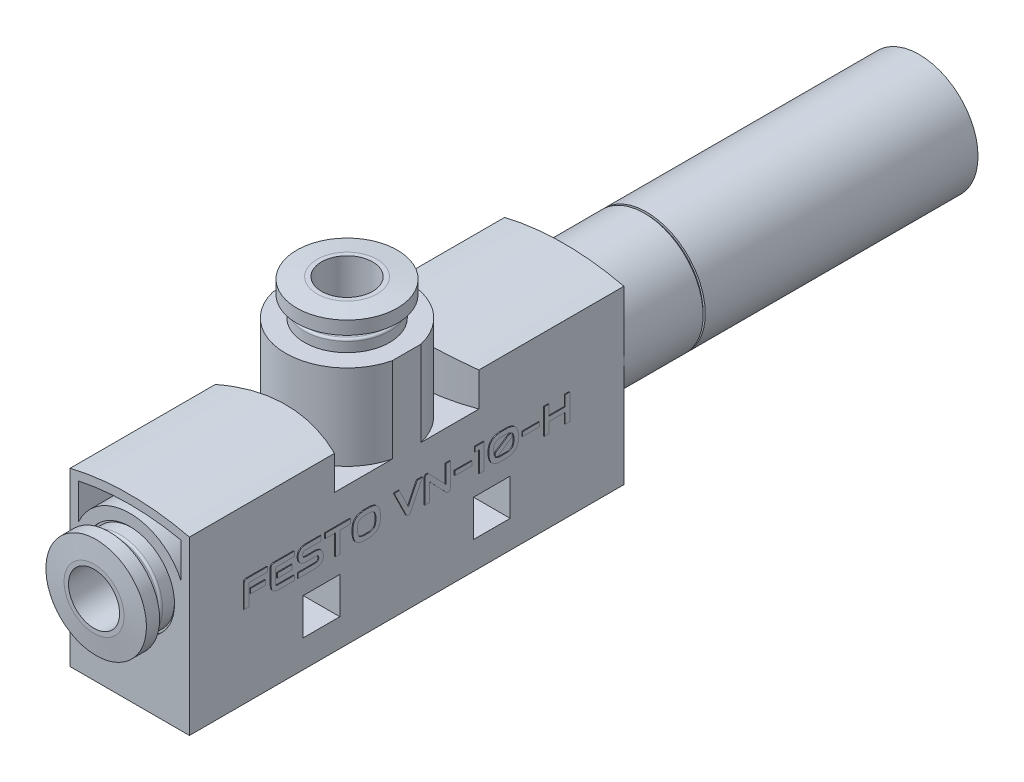
from build123d import *

# Parameters (mm, degrees)
SKETCH1_W               = 51
SKETCH1_H               = 21
BOSS_EXTRUDE1_DEPTH     = 7
CUT_EXTRUDE1_DEPTH      = 31.927334188
CUT_EXTRUDE1_DEPTH_BACK = 31.927334188
SKETCH2_W               = 4.3
SKETCH2_H               = 4.3
SKETCH3_R               = 6.9
BOSS_EXTRUDE2_DEPTH     = 42.4
SKETCH4_W               = 0.25
SKETCH4_H               = 0.25
SKETCH5_R               = 5
BOSS_EXTRUDE3_DEPTH     = 1.4
SKETCH6_R               = 4.05
BOSS_EXTRUDE4_DEPTH     = 1
SKETCH7_R               = 5.9
BOSS_EXTRUDE5_DEPTH     = 1.8
SKETCH8_R               = 3
CUT_EXTRUDE2_DEPTH      = 32.8
CHAMFER1_SIZE           = 0.25
CHAMFER1_SIZE2          = 2.378591114
CUT_EXTRUDE3_DEPTH      = 95.248660468
CUT_EXTRUDE3_DEPTH_BACK = 95.248660468
CUT_EXTRUDE4_DEPTH      = 10
CUT_EXTRUDE5_START      = -0.25
SKETCH10_3_R            = 5.25
SKETCH10_3_R_2          = 5
CUT_EXTRUDE5_DEPTH      = 0.25
BOSS_EXTRUDE6_DEPTH     = 15.7
CUT_EXTRUDE6_START      = -10
CUT_EXTRUDE6_DEPTH      = 10
SKETCH13_R              = 5
BOSS_EXTRUDE7_DEPTH     = 1.4
SKETCH14_R              = 4.05
BOSS_EXTRUDE8_DEPTH     = 1
SKETCH15_R              = 5.9
BOSS_EXTRUDE9_DEPTH     = 1.8
SKETCH16_R              = 3
CUT_EXTRUDE7_DEPTH      = 23.8
SKETCH17_R              = 3
CUT_EXTRUDE8_DEPTH      = 52.8
CHAMFER2_SIZE           = 0.25
CHAMFER2_SIZE2          = 2.378591114
FILLET1_R               = 0.25
WRAP1_OUTLINE_W         = 1.719421487
WRAP1_OUTLINE_H         = 0.547933884
WRAP1_OUTLINE_W_2       = 1.717561983
WRAP1_OUTLINE_W_3       = 1.96177686
WRAP1_OUTLINE_H_2       = 0.489669421
WRAP1_OUTLINE_W_4       = 1.961776859
WRAP1_DEPTH             = 0.1


# Read off the part's stored shape, not the designer's step: Wrap1
with BuildPart() as part:
    # Sketch1 → Boss-Extrude1 (new, symmetric)
    with BuildSketch(Plane(origin=(0, 0, 0), x_dir=(0, 0, -1), z_dir=(1, 0, 0))):
        Rectangle(SKETCH1_W, SKETCH1_H)
    extrude(amount=BOSS_EXTRUDE1_DEPTH, both=True)

    # Sketch2 → Cut-Extrude1 (cut, two sides: drawn at the far end of the back side and taken through both)
    with BuildSketch(Plane(origin=(7, 0, 0), x_dir=(0, 0, -1), z_dir=(1, 0, 0)).offset(-CUT_EXTRUDE1_DEPTH_BACK)):
        with Locations((-10, -5.1)):
            Rectangle(SKETCH2_W, SKETCH2_H)
        with Locations((10, -5.1)):
            Rectangle(SKETCH2_W, SKETCH2_H)
    extrude(amount=CUT_EXTRUDE1_DEPTH + CUT_EXTRUDE1_DEPTH_BACK, mode=Mode.SUBTRACT)

    # Sketch3 → Boss-Extrude2 (add)
    with BuildSketch(Plane(origin=(0, 0, -25.5), x_dir=(-1, 0, 0), z_dir=(0, 0, -1))):
        with Locations((0, 2)):
            Circle(SKETCH3_R)
    extrude(amount=BOSS_EXTRUDE2_DEPTH)

    # Sketch4 → Cut-Revolve6 (revolve, cut)
    with BuildSketch(Plane(origin=(0, 0, 0), x_dir=(0, 0, -1), z_dir=(1, 0, 0)), mode=Mode.PRIVATE) as cut_revolve6_sk:
        with Locations((35.025, 8.775)):
            Rectangle(SKETCH4_W, SKETCH4_H)
    revolve(cut_revolve6_sk.sketch.rotate(Axis((0, 2, -25.5), (0, 0, -1)), 90), axis=Axis((0, 2, -25.5), (0, 0, -1)), mode=Mode.SUBTRACT)

    # Sketch5 → Boss-Extrude3 (add)
    with BuildSketch(Plane.XY.offset(25.5)):
        with Locations((0, 2)):
            Circle(SKETCH5_R)
    extrude(amount=BOSS_EXTRUDE3_DEPTH)

    # Sketch6 → Boss-Extrude4 (add)
    with BuildSketch(Plane.XY.offset(26.9)):
        with Locations((0, 2)):
            Circle(SKETCH6_R)
    extrude(amount=BOSS_EXTRUDE4_DEPTH)

    # Sketch7 → Boss-Extrude5 (add)
    with BuildSketch(Plane.XY.offset(27.9)):
        with Locations((0, 2)):
            Circle(SKETCH7_R)
    extrude(amount=BOSS_EXTRUDE5_DEPTH)

    # Sketch8 → Cut-Extrude2 (cut)
    with BuildSketch(Plane.XY.offset(29.7)):
        with Locations((0, 2)):
            Circle(SKETCH8_R)
    extrude(amount=-CUT_EXTRUDE2_DEPTH, mode=Mode.SUBTRACT)

    # Chamfer1
    chamfer1_edges = [part.edges().sort_by_distance(p)[0] for p in [
        (-5.9, 2, 29.7),
    ]]
    chamfer1_side = [part.faces().sort_by_distance(p)[0] for p in [
        (-5.9, 2, 28.8),
    ]]
    chamfer(chamfer1_edges, length=CHAMFER1_SIZE, length2=CHAMFER1_SIZE2, reference=chamfer1_side[0])

    # Sketch9 → Cut-Extrude3 (cut, two sides: drawn at the far end of the back side and taken through both)
    with BuildSketch(Plane.XY.offset(25.5).offset(-CUT_EXTRUDE3_DEPTH_BACK)):
        with BuildLine():
            Line((-7, 9.671904292), (-7, 12.671904292))
            Line((-7, 12.671904292), (7, 12.671904292))
            Line((7, 12.671904292), (7, 9.671904292))
            ThreePointArc((7, 9.671904292), (0, 10.5), (-7, 9.671904292))
        make_face()
    extrude(amount=CUT_EXTRUDE3_DEPTH + CUT_EXTRUDE3_DEPTH_BACK, mode=Mode.SUBTRACT)

    # Sketch10 → Cut-Extrude4 (cut)
    with BuildSketch(Plane.XY.offset(25.5)):
        with BuildLine():
            ThreePointArc((6, 4.749545417), (0, 8.6), (-6, 4.749545417))
            Line((-6, 4.749545417), (-6, 8.872521918))
            ThreePointArc((-6, 8.872521918), (0, 9.5), (6, 8.872521918))
            Line((6, 8.872521918), (6, 4.749545417))
        make_face()
    extrude(amount=-CUT_EXTRUDE4_DEPTH, mode=Mode.SUBTRACT)

    # Sketch10<3> → Cut-Extrude5 (cut)
    with BuildSketch(Plane.XY.offset(25.5).offset(CUT_EXTRUDE5_START)):
        with Locations((0, 2)):
            Circle(SKETCH10_3_R)
        with Locations((0, 2)):
            Circle(SKETCH10_3_R_2, mode=Mode.SUBTRACT)
    extrude(amount=CUT_EXTRUDE5_DEPTH, mode=Mode.SUBTRACT)

    # Sketch11 → Boss-Extrude6 (add)
    with BuildSketch(Plane(origin=(0, 0, 0), x_dir=(1, 0, 0), z_dir=(0, 1, 0))):
        with BuildLine():
            Line((-7, -1.685229955), (-7, 1.685229955))
            ThreePointArc((-7, 1.685229955), (0, 7.2), (7, 1.685229955))
            Line((7, 1.685229955), (7, -1.685229955))
            ThreePointArc((7, -1.685229955), (0, -7.2), (-7, -1.685229955))
        make_face()
    extrude(amount=BOSS_EXTRUDE6_DEPTH)

    # Sketch12 → Cut-Extrude6 (cut)
    with BuildSketch(Plane(origin=(0, 15.7, 0), x_dir=(1, 0, 0), z_dir=(0, 1, 0)).offset(CUT_EXTRUDE6_START)):
        with BuildLine():
            Line((7, 8.476006005), (7, 1.685229955))
            ThreePointArc((7, 1.685229955), (0, 7.2), (-7, 1.685229955))
            Line((-7, 1.685229955), (-7, 8.476006005))
            ThreePointArc((-7, 8.476006005), (0, 7.211), (7, 8.476006005))
        make_face()
        with BuildLine():
            Line((7, -1.685229955), (7, -8.476006005))
            ThreePointArc((7, -8.476006005), (0, -7.211), (-7, -8.476006005))
            Line((-7, -8.476006005), (-7, -1.685229955))
            ThreePointArc((-7, -1.685229955), (0, -7.2), (7, -1.685229955))
        make_face()
    extrude(amount=CUT_EXTRUDE6_DEPTH, mode=Mode.SUBTRACT)

    # Sketch13 → Boss-Extrude7 (add)
    with BuildSketch(Plane(origin=(0, 15.7, 0), x_dir=(1, 0, 0), z_dir=(0, 1, 0))):
        with Locations(Location((0, 0, 0), (0, 0, 270))):
            Circle(SKETCH13_R)
    extrude(amount=BOSS_EXTRUDE7_DEPTH)

    # Sketch14 → Boss-Extrude8 (add)
    with BuildSketch(Plane(origin=(0, 17.1, 0), x_dir=(1, 0, 0), z_dir=(0, 1, 0))):
        with Locations(Location((0, 0, 0), (0, 0, 270))):
            Circle(SKETCH14_R)
    extrude(amount=BOSS_EXTRUDE8_DEPTH)

    # Sketch15 → Boss-Extrude9 (add)
    with BuildSketch(Plane(origin=(0, 18.1, 0), x_dir=(1, 0, 0), z_dir=(0, 1, 0))):
        with Locations(Location((0, 0, 0), (0, 0, 270))):
            Circle(SKETCH15_R)
    extrude(amount=BOSS_EXTRUDE9_DEPTH)

    # Sketch16 → Cut-Extrude7 (cut)
    with BuildSketch(Plane(origin=(0, 19.9, 0), x_dir=(1, 0, 0), z_dir=(0, 1, 0))):
        with Locations(Location((0, 0, 0), (0, 0, 270))):
            Circle(SKETCH16_R)
    extrude(amount=-CUT_EXTRUDE7_DEPTH, mode=Mode.SUBTRACT)

    # Sketch17 → Cut-Extrude8 (cut)
    with BuildSketch(Plane.XY.offset(29.7)):
        with Locations((0, 2)):
            Circle(SKETCH17_R)
    extrude(amount=-CUT_EXTRUDE8_DEPTH, mode=Mode.SUBTRACT)

    # Chamfer2
    chamfer2_edges = [part.edges().sort_by_distance(p)[0] for p in [
        (0, 19.9, -5.9),
    ]]
    chamfer2_side = [part.faces().sort_by_distance(p)[0] for p in [
        (0, 19, -5.9),
    ]]
    chamfer(chamfer2_edges, length=CHAMFER2_SIZE, length2=CHAMFER2_SIZE2, reference=chamfer2_side[0])

    # Fillet1
    fillet1_edges = [part.edges().sort_by_distance(p)[0] for p in [
        (0, 17.1, -5),
        (0, 18.1, -4.05),
        (-5, 2, 26.9),
        (-4.05, 2, 27.9),
    ]]
    fillet(fillet1_edges, radius=FILLET1_R)

    # Sketch18 → Cut-Revolve7 (revolve, cut)
    with BuildSketch(Plane(origin=(0, 0, 0), x_dir=(0, 0, -1), z_dir=(1, 0, 0)), mode=Mode.PRIVATE) as cut_revolve7_sk:
        with BuildLine():
            Line((67.166284919, 8.9), (67.9, 8.9))
            Line((67.9, 8.9), (67.9, 2.3))
            ThreePointArc((67.9, 2.3), (67.700851226, 5.618644008), (67.166284919, 8.9))
        make_face()
    revolve(cut_revolve7_sk.sketch.rotate(Axis((0, 2, -67.9), (0, 0, 1)), 270), axis=Axis((0, 2, -67.9), (0, 0, 1)), mode=Mode.SUBTRACT)

    # Wrap1 outline → Wrap1 (add)
    # profile 1 of 15: a face of its own
    with BuildSketch(Plane(origin=(7, 0, 0), x_dir=(0, 0, -1), z_dir=(1, 0, 0))):
        with BuildLine():
            Line((-16.454340135, 2.182735767), (-18.903926912, 2.182735767))
            add(Edge.make_bspline(
                [(-18.903926912, 2.182735767), (-18.969694475, 2.170143217), (-19.118134917, 2.141721249), (-19.15651714, 1.99209958), (-19.177893854, 1.908768825)],
                knots=[0, 0, 0, 0, 0.443056907, 1, 1, 1, 1], degree=3))
            Line((-19.177893854, 1.908768825), (-19.177893854, -0.817264233))
            Line((-19.177893854, -0.817264233), (-18.634298813, -0.817264233))
            Line((-18.634298813, -0.817264233), (-18.634298813, 1.638520891))
            Line((-18.634298813, 1.638520891), (-16.454340135, 1.638520891))
            Line((-16.454340135, 1.638520891), (-16.454340135, 2.182735767))
        make_face()
    # profile 2 of 15: a face of its own
    with BuildSketch(Plane(origin=(7, 0, 0), x_dir=(0, 0, -1), z_dir=(1, 0, 0))):
        with BuildLine():
            Line((-13.29318311, 2.182735767), (-15.742769887, 2.182735767))
            add(Edge.make_bspline(
                [(-15.742769887, 2.182735767), (-15.808512332, 2.170120728), (-15.956968711, 2.141634063), (-15.995749542, 1.992089212), (-16.017356664, 1.908768825)],
                knots=[0, 0, 0, 0, 0.442840146, 1, 1, 1, 1], degree=3))
            Line((-16.017356664, 1.908768825), (-16.017356664, -0.05362787))
            add(Edge.make_bspline(
                [(-16.017356664, -0.05362787), (-15.984779507, -0.238239805), (-15.911146952, -0.655509133), (-15.490256327, -0.759359983), (-15.255579804, -0.817264233)],
                knots=[0, 0, 0, 0, 0.442428723, 1, 1, 1, 1], degree=3))
            Line((-15.255579804, -0.817264233), (-13.29318311, -0.817264233))
            Line((-13.29318311, -0.817264233), (-13.29318311, -0.273049357))
            Line((-13.29318311, -0.273049357), (-15.251240961, -0.273049357))
            add(Edge.make_bspline(
                [(-15.251240961, -0.273049357), (-15.307376887, -0.266690624), (-15.433586386, -0.252394385), (-15.459020405, -0.124588039), (-15.473141788, -0.05362787)],
                knots=[0, 0, 0, 0, 0.444783684, 1, 1, 1, 1], degree=3))
            Line((-15.473141788, -0.05362787), (-15.473141788, 1.638520891))
            Line((-15.473141788, 1.638520891), (-13.29318311, 1.638520891))
            Line((-13.29318311, 1.638520891), (-13.29318311, 2.182735767))
        make_face()
    # profile 3 of 15: a face of its own
    with BuildSketch(Plane(origin=(7, 0, 0), x_dir=(0, 0, -1), z_dir=(1, 0, 0))):
        with BuildLine():
            add(Edge.make_bspline(
                [(-11.994629391, 0.956702709), (-12.077491889, 0.969694719), (-12.264568141, 0.999026403), (-12.301788031, 1.189593764), (-12.322521953, 1.295752296)],
                knots=[0, 0, 0, 0, 0.442934349, 1, 1, 1, 1], degree=3))
            add(Edge.make_bspline(
                [(-12.322521953, 1.295752296), (-12.311513804, 1.379303455), (-12.286809256, 1.566809406), (-12.098840671, 1.612943681), (-11.994629391, 1.638520891)],
                knots=[0, 0, 0, 0, 0.445592044, 1, 1, 1, 1], degree=3))
            Line((-11.994629391, 1.638520891), (-10.14318311, 1.638520891))
            Line((-10.14318311, 1.638520891), (-10.14318311, 2.182735767))
            Line((-10.14318311, 2.182735767), (-11.994629391, 2.182735767))
            add(Edge.make_bspline(
                [(-11.994629391, 2.182735767), (-12.198498835, 2.142975285), (-12.533369245, 2.077665797), (-12.831559736, 1.68552903), (-12.855004528, 1.425751042), (-12.866736829, 1.295752296)],
                knots=[0, 0, 0, 0, 0.437400834, 0.718462728, 1, 1, 1, 1], degree=3))
            add(Edge.make_bspline(
                [(-12.866736829, 1.295752296), (-12.832567168, 1.08998221), (-12.776400266, 0.751744493), (-12.38156296, 0.457993614), (-12.12372384, 0.42519192), (-11.994629391, 0.408768825)],
                knots=[0, 0, 0, 0, 0.436818656, 0.718027329, 1, 1, 1, 1], degree=3))
            Line((-11.994629391, 0.408768825), (-10.74318311, 0.408768825))
            add(Edge.make_bspline(
                [(-10.74318311, 0.408768825), (-10.660819761, 0.393957033), (-10.474749543, 0.360495144), (-10.434978009, 0.170997532), (-10.412811209, 0.065380395)],
                knots=[0, 0, 0, 0, 0.442646603, 1, 1, 1, 1], degree=3))
            add(Edge.make_bspline(
                [(-10.412811209, 0.065380395), (-10.424026212, -0.018173598), (-10.449220034, -0.205872559), (-10.638281921, -0.249077211), (-10.74318311, -0.273049357)],
                knots=[0, 0, 0, 0, 0.445148936, 1, 1, 1, 1], degree=3))
            Line((-10.74318311, -0.273049357), (-12.841323606, -0.273049357))
            Line((-12.841323606, -0.273049357), (-12.841323606, -0.817264233))
            Line((-12.841323606, -0.817264233), (-10.74318311, -0.817264233))
            add(Edge.make_bspline(
                [(-10.74318311, -0.817264233), (-10.538810125, -0.778576497), (-10.2036062, -0.715122508), (-9.907394854, -0.322760132), (-9.881958384, -0.06416231), (-9.869216168, 0.065380395)],
                knots=[0, 0, 0, 0, 0.438071192, 0.718505835, 1, 1, 1, 1], degree=3))
            add(Edge.make_bspline(
                [(-9.869216168, 0.065380395), (-9.903730277, 0.270911206), (-9.960482689, 0.608870655), (-10.355622895, 0.898398577), (-10.611470361, 0.937260909), (-10.739464102, 0.956702709)],
                knots=[0, 0, 0, 0, 0.436804136, 0.718247958, 1, 1, 1, 1], degree=3))
            Line((-10.739464102, 0.956702709), (-11.994629391, 0.956702709))
        make_face()
    # profile 4 of 15: a face of its own
    with BuildSketch(Plane(origin=(7, 0, 0), x_dir=(0, 0, -1), z_dir=(1, 0, 0))):
        with BuildLine():
            Line((-6.419216168, 0.969099403), (-6.419216168, 0.39637213))
            add(Edge.make_bspline(
                [(-6.419216168, 0.39637213), (-6.36645411, 0.103991405), (-6.279762337, -0.376410692), (-5.717785404, -0.797610449), (-5.348739685, -0.838386699), (-5.164050879, -0.858793159)],
                knots=[0, 0, 0, 0, 0.437197005, 0.71834543, 1, 1, 1, 1], degree=3))
            Line((-5.164050879, -0.858793159), (-4.427687242, -0.858793159))
            add(Edge.make_bspline(
                [(-4.427687242, -0.858793159), (-4.135727931, -0.805882382), (-3.65600005, -0.718942957), (-3.237278342, -0.156467013), (-3.197012294, 0.211979721), (-3.176860796, 0.39637213)],
                knots=[0, 0, 0, 0, 0.437168661, 0.718326106, 1, 1, 1, 1], degree=3))
            Line((-3.176860796, 0.39637213), (-3.176860796, 0.969099403))
            add(Edge.make_bspline(
                [(-3.176860796, 0.969099403), (-3.229009475, 1.261119544), (-3.314693809, 1.74093134), (-3.875506872, 2.161174834), (-4.243535427, 2.203224263), (-4.427687242, 2.224264692)],
                knots=[0, 0, 0, 0, 0.437231575, 0.718405472, 1, 1, 1, 1], degree=3))
            Line((-4.427687242, 2.224264692), (-5.164050879, 2.224264692))
            add(Edge.make_bspline(
                [(-5.164050879, 2.224264692), (-5.456177943, 2.171168111), (-5.936181486, 2.08392338), (-6.357629839, 1.522622937), (-6.398675874, 1.153710769), (-6.419216168, 0.969099403)],
                knots=[0, 0, 0, 0, 0.437187287, 0.718356744, 1, 1, 1, 1], degree=3))
        make_face()
        with BuildLine():
            Line((-3.720455837, 0.969099403), (-3.720455837, 0.39637213))
            add(Edge.make_bspline(
                [(-3.720455837, 0.39637213), (-3.74868016, 0.221557135), (-3.812300186, -0.172490752), (-4.210489221, -0.264183722), (-4.432026085, -0.315198118)],
                knots=[0, 0, 0, 0, 0.443638961, 1, 1, 1, 1], degree=3))
            Line((-4.432026085, -0.315198118), (-5.164050879, -0.315198118))
            add(Edge.make_bspline(
                [(-5.164050879, -0.315198118), (-5.338868639, -0.28687002), (-5.732784481, -0.223038482), (-5.824569701, 0.1749878), (-5.875621127, 0.39637213)],
                knots=[0, 0, 0, 0, 0.443794693, 1, 1, 1, 1], degree=3))
            Line((-5.875621127, 0.39637213), (-5.875621127, 0.969099403))
            add(Edge.make_bspline(
                [(-5.875621127, 0.969099403), (-5.847264052, 1.143779007), (-5.783337841, 1.537564516), (-5.385443163, 1.629510213), (-5.164050879, 1.680669651)],
                knots=[0, 0, 0, 0, 0.443590737, 1, 1, 1, 1], degree=3))
            Line((-5.164050879, 1.680669651), (-4.427687242, 1.680669651))
            add(Edge.make_bspline(
                [(-4.427687242, 1.680669651), (-4.253694212, 1.65173873), (-3.86151536, 1.586528673), (-3.770880099, 1.189810591), (-3.720455837, 0.969099403)],
                knots=[0, 0, 0, 0, 0.443657351, 1, 1, 1, 1], degree=3))
        make_face(mode=Mode.SUBTRACT)
    # profile 5 of 15: a face of its own
    with BuildSketch(Plane(origin=(7, 0, 0), x_dir=(0, 0, -1), z_dir=(1, 0, 0))):
        with BuildLine():
            Line((-1.573968234, 2.182735767), (-0.155786416, -0.710652663))
            add(Edge.make_bspline(
                [(-0.155786416, -0.710652663), (-0.129596122, -0.747660934), (-0.07032208, -0.831418293), (0.031959777, -0.84898713), (0.089048295, -0.858793159)],
                knots=[0, 0, 0, 0, 0.441850987, 1, 1, 1, 1], degree=3))
            add(Edge.make_bspline(
                [(0.089048295, -0.858793159), (0.134248282, -0.853313976), (0.23658428, -0.840908715), (0.299022587, -0.757321111), (0.333883005, -0.710652663)],
                knots=[0, 0, 0, 0, 0.441682186, 1, 1, 1, 1], degree=3))
            Line((0.333883005, -0.710652663), (1.754544163, 2.182735767))
            Line((1.754544163, 2.182735767), (1.147725981, 2.182735767))
            Line((1.147725981, 2.182735767), (0.089048295, 0.02137213))
            Line((0.089048295, 0.02137213), (-0.965290548, 2.182735767))
            Line((-0.965290548, 2.182735767), (-1.573968234, 2.182735767))
        make_face()
    # profile 6 of 15: a face of its own
    with BuildSketch(Plane(origin=(7, 0, 0), x_dir=(0, 0, -1), z_dir=(1, 0, 0))):
        with BuildLine():
            Line((4.499172262, 0.069719238), (2.511362344, 2.143066345))
            add(Edge.make_bspline(
                [(2.511362344, 2.143066345), (2.47250763, 2.17295761), (2.384402337, 2.240737768), (2.274203059, 2.217050984), (2.212602014, 2.203810147)],
                knots=[0, 0, 0, 0, 0.441003181, 1, 1, 1, 1], degree=3))
            add(Edge.make_bspline(
                [(2.212602014, 2.203810147), (2.171387459, 2.178183187), (2.078183575, 2.120229578), (2.057040369, 2.011145234), (2.045246642, 1.95029775)],
                knots=[0, 0, 0, 0, 0.442197827, 1, 1, 1, 1], degree=3))
            Line((2.045246642, 1.95029775), (2.045246642, -0.817264233))
            Line((2.045246642, -0.817264233), (2.588841683, -0.817264233))
            Line((2.588841683, -0.817264233), (2.588841683, 1.295752296))
            Line((2.588841683, 1.295752296), (4.576031766, -0.779454316))
            add(Edge.make_bspline(
                [(4.576031766, -0.779454316), (4.600283124, -0.800227901), (4.655383509, -0.847426598), (4.7280927, -0.854713464), (4.768800361, -0.858793159)],
                knots=[0, 0, 0, 0, 0.440130464, 1, 1, 1, 1], degree=3))
            add(Edge.make_bspline(
                [(4.768800361, -0.858793159), (4.834473495, -0.846173667), (4.982815195, -0.817668908), (5.021313041, -0.668150528), (5.042767303, -0.584826217)],
                knots=[0, 0, 0, 0, 0.442715263, 1, 1, 1, 1], degree=3))
            Line((5.042767303, -0.584826217), (5.042767303, 2.182735767))
            Line((5.042767303, 2.182735767), (4.499172262, 2.182735767))
            Line((4.499172262, 2.182735767), (4.499172262, 0.069719238))
        make_face()
    # profile 7 of 15: a face of its own
    with BuildSketch(Plane(origin=(7, 0, 0), x_dir=(0, 0, -1), z_dir=(1, 0, 0))):
        with BuildLine():
            Line((9.544626807, 0.927570477), (9.544626807, 0.437901056))
            add(Edge.make_bspline(
                [(9.544626807, 0.437901056), (9.602224245, 0.149250353), (9.696936653, -0.325402757), (10.251147521, -0.745091951), (10.616926542, -0.793208907), (10.799792096, -0.817264233)],
                knots=[0, 0, 0, 0, 0.436947824, 0.718510789, 1, 1, 1, 1], degree=3))
            Line((10.799792096, -0.817264233), (11.780990444, -0.817264233))
            add(Edge.make_bspline(
                [(11.780990444, -0.817264233), (12.068114428, -0.757425583), (12.54004882, -0.659071148), (12.968102018, -0.111983927), (13.013468822, 0.25458716), (13.036155733, 0.437901056)],
                knots=[0, 0, 0, 0, 0.437154564, 0.718533749, 1, 1, 1, 1], degree=3))
            Line((13.036155733, 0.437901056), (13.036155733, 0.927570477))
            add(Edge.make_bspline(
                [(13.036155733, 0.927570477), (12.977801875, 1.21558092), (12.881830076, 1.689257918), (12.329125855, 2.109350801), (11.963682686, 2.15827673), (11.780990444, 2.182735767)],
                knots=[0, 0, 0, 0, 0.436853423, 0.718471927, 1, 1, 1, 1], degree=3))
            Line((11.780990444, 2.182735767), (10.799792096, 2.182735767))
            add(Edge.make_bspline(
                [(10.799792096, 2.182735767), (10.512037501, 2.123636744), (10.039064967, 2.026497672), (9.613293458, 1.477127996), (9.567512816, 1.110733306), (9.544626807, 0.927570477)],
                knots=[0, 0, 0, 0, 0.437236815, 0.718671422, 1, 1, 1, 1], degree=3))
        make_face()
        with BuildLine():
            Line((12.487602014, 0.927570477), (12.487602014, 0.437901056))
            add(Edge.make_bspline(
                [(12.487602014, 0.437901056), (12.459191809, 0.264220297), (12.395188644, -0.12705173), (12.000488263, -0.220873756), (11.780990444, -0.273049357)],
                knots=[0, 0, 0, 0, 0.443887492, 1, 1, 1, 1], degree=3))
            Line((11.780990444, -0.273049357), (10.799792096, -0.273049357))
            add(Edge.make_bspline(
                [(10.799792096, -0.273049357), (10.628173488, -0.241347306), (10.240994702, -0.169826146), (10.142858674, 0.220556913), (10.088221848, 0.437901056)],
                knots=[0, 0, 0, 0, 0.443254163, 1, 1, 1, 1], degree=3))
            Line((10.088221848, 0.437901056), (10.088221848, 0.927570477))
            add(Edge.make_bspline(
                [(10.088221848, 0.927570477), (10.12034017, 1.09898665), (10.192787148, 1.485637734), (10.582726644, 1.583849752), (10.799792096, 1.638520891)],
                knots=[0, 0, 0, 0, 0.443335555, 1, 1, 1, 1], degree=3))
            Line((10.799792096, 1.638520891), (11.780990444, 1.638520891))
            add(Edge.make_bspline(
                [(11.780990444, 1.638520891), (11.951618053, 1.606365298), (12.337050469, 1.533728708), (12.433724656, 1.144494214), (12.487602014, 0.927570477)],
                knots=[0, 0, 0, 0, 0.442691385, 1, 1, 1, 1], degree=3))
        make_face(mode=Mode.SUBTRACT)
    # profile 8 of 15: a face of its own
    with BuildSketch(Plane(origin=(7, 0, 0), x_dir=(0, 0, -1), z_dir=(1, 0, 0))):
        with BuildLine():
            add(Edge.make_bspline(
                [(10.328717716, 0.040587006), (10.354299792, 0.009521668), (10.412373551, -0.060999621), (10.50380334, -0.073760829), (10.554957386, -0.080900597)],
                knots=[0, 0, 0, 0, 0.44051008, 1, 1, 1, 1], degree=3))
            add(Edge.make_bspline(
                [(10.554957386, -0.080900597), (10.578868435, -0.079748895), (10.633109153, -0.077136332), (10.679587834, -0.048542335), (10.70557722, -0.03255349)],
                knots=[0, 0, 0, 0, 0.440832097, 1, 1, 1, 1], degree=3))
            Line((10.70557722, -0.03255349), (12.17396565, 0.948644858))
            add(Edge.make_bspline(
                [(12.17396565, 0.948644858), (12.221855489, 0.994837183), (12.329949297, 1.099099476), (12.279527778, 1.244116043), (12.251444989, 1.324884527)],
                knots=[0, 0, 0, 0, 0.44303961, 1, 1, 1, 1], degree=3))
            add(Edge.make_bspline(
                [(12.251444989, 1.324884527), (12.204443881, 1.371364571), (12.098570596, 1.476064124), (11.955025425, 1.425912478), (11.87520532, 1.398025023)],
                knots=[0, 0, 0, 0, 0.443937372, 1, 1, 1, 1], degree=3))
            Line((11.87520532, 1.398025023), (10.402478047, 0.416826676))
            add(Edge.make_bspline(
                [(10.402478047, 0.416826676), (10.355292109, 0.370322253), (10.248639867, 0.265210408), (10.300051839, 0.120996593), (10.328717716, 0.040587006)],
                knots=[0, 0, 0, 0, 0.442427989, 1, 1, 1, 1], degree=3))
        make_face()
    # profile 9 of 15: a face of its own
    with BuildSketch(Plane(origin=(7, 0, 0), x_dir=(0, 0, -1), z_dir=(1, 0, 0))):
        with Locations((-17.557026085, 0.682735767)):
            Rectangle(WRAP1_OUTLINE_W, WRAP1_OUTLINE_H)
    # profile 10 of 15: a face of its own
    with BuildSketch(Plane(origin=(7, 0, 0), x_dir=(0, 0, -1), z_dir=(1, 0, 0))):
        with Locations((-14.396798813, 0.682735767)):
            Rectangle(WRAP1_OUTLINE_W_2, WRAP1_OUTLINE_H)
    # profile 11 of 15: a face of its own
    with BuildSketch(Plane(origin=(7, 0, 0), x_dir=(0, 0, -1), z_dir=(1, 0, 0))):
        Polygon((18.506197055, 0.956702709), (16.596486311, 0.956702709), (16.596486311, 2.182735767), (16.052271435, 2.182735767), (16.052271435, -0.817264233), (16.596486311, -0.817264233), (16.596486311, 0.408768825), (18.506197055, 0.408768825), (18.506197055, -0.817264233), (19.050411931, -0.817264233), (19.050411931, 2.182735767), (18.506197055, 2.182735767), align=None)
    # profile 12 of 15: a face of its own
    with BuildSketch(Plane(origin=(7, 0, 0), x_dir=(0, 0, -1), z_dir=(1, 0, 0))):
        Polygon((-8.45103435, -0.817264233), (-7.906819474, -0.817264233), (-7.906819474, 1.638520891), (-6.708059143, 1.638520891), (-6.708059143, 2.182735767), (-9.651654185, 2.182735767), (-9.651654185, 1.638520891), (-8.45103435, 1.638520891), align=None)
    # profile 13 of 15: a face of its own
    with BuildSketch(Plane(origin=(7, 0, 0), x_dir=(0, 0, -1), z_dir=(1, 0, 0))):
        Polygon((8.438841683, -0.817264233), (8.984916063, -0.817264233), (8.984916063, 2.182735767), (7.947312758, 2.182735767), (7.947312758, 1.638520891), (8.438841683, 1.638520891), align=None)
    # profile 14 of 15: a face of its own
    with BuildSketch(Plane(origin=(7, 0, 0), x_dir=(0, 0, -1), z_dir=(1, 0, 0))):
        with Locations((6.562911931, 0.682735767)):
            Rectangle(WRAP1_OUTLINE_W_3, WRAP1_OUTLINE_H_2)
    # profile 15 of 15: a face of its own
    with BuildSketch(Plane(origin=(7, 0, 0), x_dir=(0, 0, -1), z_dir=(1, 0, 0))):
        with Locations((14.496796229, 0.682735767)):
            Rectangle(WRAP1_OUTLINE_W_4, WRAP1_OUTLINE_H_2)
    extrude(amount=WRAP1_DEPTH)


solid = part.part
